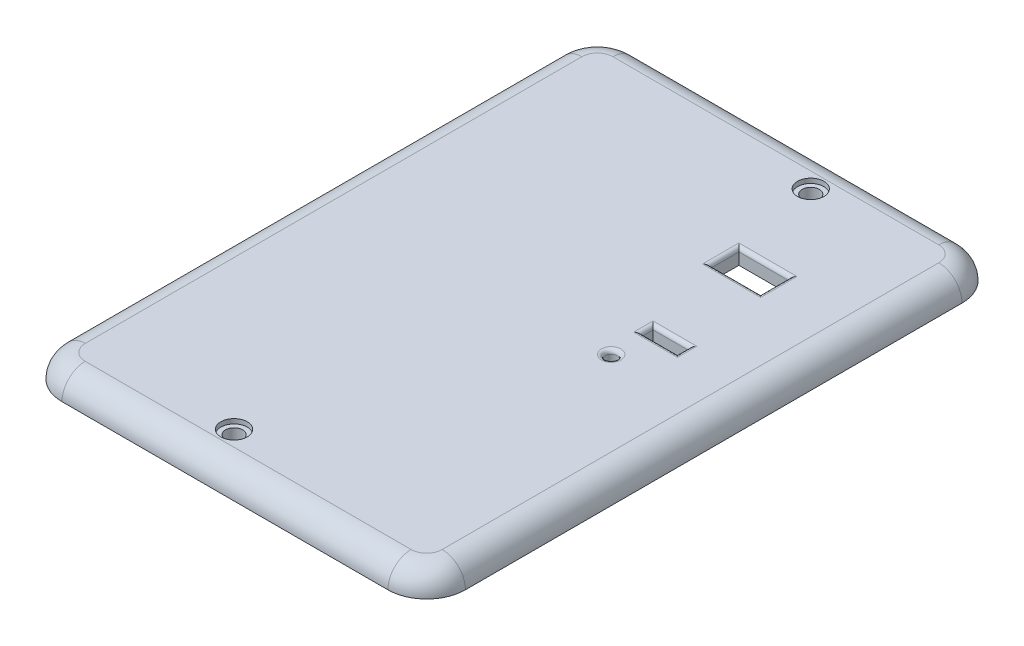
from build123d import *

# Parameters (mm, degrees)
BOSS_EXTRUDE1_DEPTH = 3
CUT_EXTRUDE1_DEPTH  = 1
FILLET1_R           = 3
SKETCH6_W           = 12
SKETCH6_H           = 20.5
BOSS_EXTRUDE3_DEPTH = 4.5
SKETCH28_W          = 0.3
SKETCH28_H          = 20.5
CUT_EXTRUDE18_DEPTH = 4.5
SKETCH44_R          = 1.1
CUT_EXTRUDE26_DEPTH = 10
SKETCH45_R          = 1.1
CUT_EXTRUDE27_DEPTH = 10
SKETCH47_R          = 1.7
CUT_EXTRUDE29_DEPTH = 0.6
SKETCH13_W          = 3
SKETCH13_H          = 20.5
CUT_EXTRUDE30_DEPTH = 3
SKETCH49_W          = 6.485663297
SKETCH49_H          = 3.694682329
CUT_EXTRUDE31_DEPTH = 8
SKETCH48_R          = 0.75
SKETCH48_W          = 4.647178446
SKETCH48_H          = 1.5
CUT_EXTRUDE33_DEPTH = 8
FILLET2_R           = 0.5
BOSS_EXTRUDE4_DEPTH = 1


with BuildPart() as part:
    # Sketch1 → Boss-Extrude1 (new body)
    with BuildSketch(Plane(origin=(0, 0, 0), x_dir=(1, 0, 0), z_dir=(0, 1, 0))):
        with BuildLine():
            Line((-19.206896552, 30.931034483), (22.793103448, 30.931034483))
            ThreePointArc((22.793103448, 30.931034483), (26.328637354, 29.466568389), (27.793103448, 25.931034483))
            Line((27.793103448, 25.931034483), (27.793103448, -38.068965517))
            ThreePointArc((27.793103448, -38.068965517), (26.328637354, -41.604499423), (22.793103448, -43.068965517))
            Line((22.793103448, -43.068965517), (-19.206896552, -43.068965517))
            ThreePointArc((-19.206896552, -43.068965517), (-22.742430458, -41.604499423), (-24.206896552, -38.068965517))
            Line((-24.206896552, -38.068965517), (-24.206896552, 25.931034483))
            ThreePointArc((-24.206896552, 25.931034483), (-22.742430458, 29.466568389), (-19.206896552, 30.931034483))
        make_face()
    extrude(amount=BOSS_EXTRUDE1_DEPTH)

    # Sketch3 → Cut-Extrude1 (cut)
    with BuildSketch(Plane(origin=(0, 0, 0), x_dir=(-1, 0, 0), z_dir=(0, -1, 0))):
        with BuildLine():
            Line((18.206896552, 29.931034483), (-21.793103448, 29.931034483))
            ThreePointArc((-21.793103448, 29.931034483), (-25.328637354, 28.466568389), (-26.793103448, 24.931034483))
            Line((-26.793103448, 24.931034483), (-26.793103448, -37.068965517))
            ThreePointArc((-26.793103448, -37.068965517), (-25.328637354, -40.604499423), (-21.793103448, -42.068965517))
            Line((-21.793103448, -42.068965517), (18.206896552, -42.068965517))
            ThreePointArc((18.206896552, -42.068965517), (21.742430458, -40.604499423), (23.206896552, -37.068965517))
            Line((23.206896552, -37.068965517), (23.206896552, 24.931034483))
            ThreePointArc((23.206896552, 24.931034483), (21.742430458, 28.466568389), (18.206896552, 29.931034483))
        make_face()
    extrude(amount=-CUT_EXTRUDE1_DEPTH, mode=Mode.SUBTRACT)

    # Fillet1
    fillet1_edges = [part.edges().sort_by_distance(p)[0] for p in [
        (-22.742430458, 3, -29.466568389),
        (1.793103448, 3, -30.931034483),
        (26.328637354, 3, -29.466568389),
        (27.793103448, 3, 6.068965517),
        (26.328637354, 3, 41.604499423),
        (1.793103448, 3, 43.068965517),
        (-22.742430458, 3, 41.604499423),
        (-24.206896552, 3, 6.068965517),
    ]]
    fillet(fillet1_edges, radius=FILLET1_R - 0.0001)  # a hair under: the kernel refuses the full size

    # Sketch6 → Boss-Extrude3 (add)
    with BuildSketch(Plane.XZ.offset(-1)):
        with Locations((-16.606896552, 6.018965517)):
            Rectangle(SKETCH6_W, SKETCH6_H)
    extrude(amount=BOSS_EXTRUDE3_DEPTH)

    # Sketch28 → Cut-Extrude18 (cut)
    with BuildSketch(Plane.XZ.offset(3.5)):
        with Locations((-22.456896552, 6.018965517)):
            Rectangle(SKETCH28_W, SKETCH28_H)
    extrude(amount=-CUT_EXTRUDE18_DEPTH, mode=Mode.SUBTRACT)

    # Sketch44 → Cut-Extrude26 (cut)
    with BuildSketch(Plane.XZ.offset(-1)):
        with Locations(Location((-2.026896552, 38.068965517, 0), (0, 0, 270))):
            Circle(SKETCH44_R)
    extrude(amount=-CUT_EXTRUDE26_DEPTH, mode=Mode.SUBTRACT)

    # Sketch45 → Cut-Extrude27 (cut)
    with BuildSketch(Plane.XZ.offset(-1)):
        with Locations(Location((8.293103448, -25.931034483, 0), (0, 0, 270))):
            Circle(SKETCH45_R)
    extrude(amount=-CUT_EXTRUDE27_DEPTH, mode=Mode.SUBTRACT)

    # Sketch47 → Cut-Extrude29 (cut)
    with BuildSketch(Plane(origin=(0, 3, 0), x_dir=(1, 0, 0), z_dir=(0, 1, 0))):
        with Locations(Location((8.293103448, 25.931034483, 0), (0, 0, 270))):
            Circle(SKETCH47_R)
        with Locations(Location((-2.026896552, -38.068965517, 0), (0, 0, 270))):
            Circle(SKETCH47_R)
    extrude(amount=-CUT_EXTRUDE29_DEPTH, mode=Mode.SUBTRACT)

    # Sketch13 → Cut-Extrude30 (cut)
    with BuildSketch(Plane.XZ.offset(3.5)):
        with Locations((-13.606896552, 6.018965517)):
            Rectangle(SKETCH13_W, SKETCH13_H)
    extrude(amount=-CUT_EXTRUDE30_DEPTH, mode=Mode.SUBTRACT)

    # Sketch49 → Cut-Extrude31 (cut)
    with BuildSketch(Plane(origin=(0, 3, 0), x_dir=(1, 0, 0), z_dir=(0, 1, 0))):
        with Locations((13.444488672, 12.922014382)):
            Rectangle(SKETCH49_W, SKETCH49_H)
    extrude(amount=-CUT_EXTRUDE31_DEPTH, mode=Mode.SUBTRACT)

    # Sketch48 → Cut-Extrude33 (cut)
    with BuildSketch(Plane(origin=(0, 3, 0), x_dir=(1, 0, 0), z_dir=(0, 1, 0))):
        with Locations(Location((13.919849349, -5.418160984, 0), (0, 0, 270))):
            Circle(SKETCH48_R)
        with Locations((15.692920165, -0.222236134)):
            Rectangle(SKETCH48_W, SKETCH48_H)
    extrude(amount=-CUT_EXTRUDE33_DEPTH, mode=Mode.SUBTRACT)

    # Fillet2
    fillet2_edges = [part.edges().sort_by_distance(p)[0] for p in [
        (10.201657023, 3, -12.922014382),
        (13.444488671, 3, -11.074673217),
        (16.68732032, 3, -12.922014382),
        (13.444488671, 3, -14.769355546),
        (13.369330942, 3, 0.222236134),
        (15.692920165, 3, 0.972236134),
        (18.016509388, 3, 0.222236134),
        (15.692920165, 3, -0.527763866),
        (13.919849349, 3, 4.668160984),
    ]]
    fillet(fillet2_edges, radius=FILLET2_R)

    # Sketch51 → Boss-Extrude4 (add)
    with BuildSketch(Plane(origin=(0, 0, 0), x_dir=(1, 0, 0), z_dir=(0, 1, 0))):
        with BuildLine():
            Line((26.793103448, 24.931034483), (26.793103448, -37.068965517))
            ThreePointArc((26.793103448, -37.068965517), (25.328637354, -40.604499423), (21.793103448, -42.068965517))
            Line((21.793103448, -42.068965517), (-18.206896552, -42.068965517))
            ThreePointArc((-18.206896552, -42.068965517), (-21.742430458, -40.604499423), (-23.206896552, -37.068965517))
            Line((-23.206896552, -37.068965517), (-23.206896552, 24.931034483))
            ThreePointArc((-23.206896552, 24.931034483), (-21.742430458, 28.466568389), (-18.206896552, 29.931034483))
            Line((-18.206896552, 29.931034483), (21.793103448, 29.931034483))
            ThreePointArc((21.793103448, 29.931034483), (25.328637354, 28.466568389), (26.793103448, 24.931034483))
        make_face()
        with BuildLine():
            Line((21.793103448, -41.568965517), (-18.206896552, -41.568965517))
            ThreePointArc((-18.206896552, -41.568965517), (-21.388877067, -40.250946033), (-22.706896552, -37.068965517))
            Line((-22.706896552, -37.068965517), (-22.706896552, 24.931034483))
            ThreePointArc((-22.706896552, 24.931034483), (-21.388877067, 28.113014998), (-18.206896552, 29.431034483))
            Line((-18.206896552, 29.431034483), (21.793103448, 29.431034483))
            ThreePointArc((21.793103448, 29.431034483), (24.975083964, 28.113014998), (26.293103448, 24.931034483))
            Line((26.293103448, 24.931034483), (26.293103448, -37.068965517))
            ThreePointArc((26.293103448, -37.068965517), (24.975083964, -40.250946033), (21.793103448, -41.568965517))
        make_face(mode=Mode.SUBTRACT)
    extrude(amount=BOSS_EXTRUDE4_DEPTH)


solid = part.part
